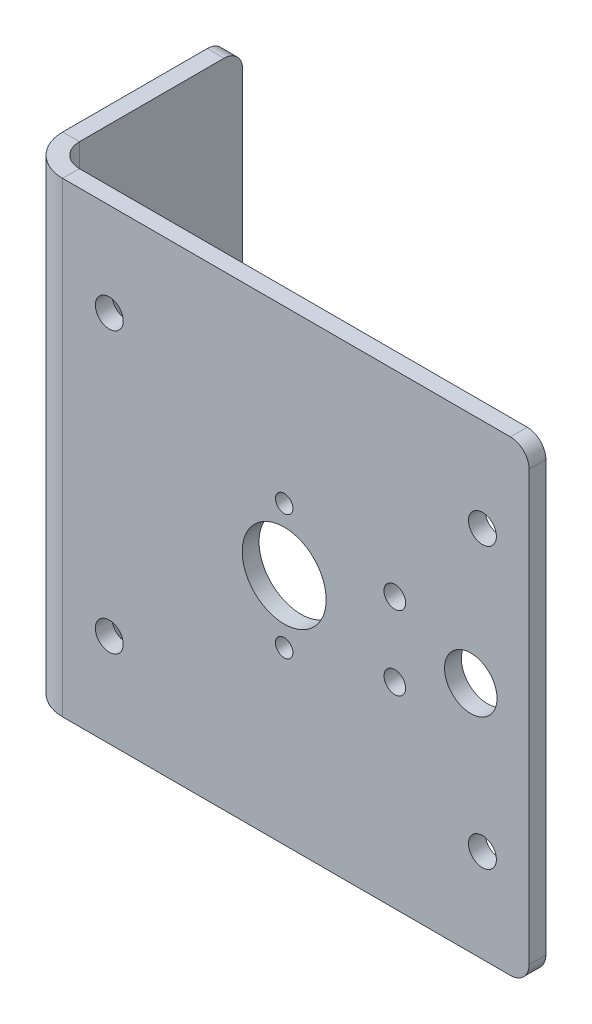
from build123d import *

# Parameters (mm, degrees)
BASE_FLANGE1_DEPTH              = 31.75
FILLET1_R                       = 2.54
F_25_0_1495_DIAMETER_HOLE1_D    = 3.7973
SKETCH10_R                      = 5.715
CUT_EXTRUDE1_DEPTH              = 56.168930099
F_9_32_0_28125_DIAMETER_HOLE1_D = 7.14375
F_3_32_0_09375_DIAMETER_HOLE1_D = 2.38125
F_32_0_116_DIAMETER_HOLE1_D     = 2.9464


# Sheet-metal steps are written as plain solids
with BuildPart() as part:
    # Sketch3 → Base-Flange1 (new, symmetric)
    with BuildSketch(Plane(origin=(0, 0, 0), x_dir=(-1, 0, 0), z_dir=(0, 1, 0))):
        with BuildLine():
            Line((-33.3375, 0), (30.1625, 0))
            ThreePointArc((30.1625, 0), (32.40756403, -0.92993597), (33.3375, -3.175))
            Line((33.3375, -3.175), (33.3375, -25.4))
            Line((33.3375, -25.4), (35.6235, -25.4))
            Line((35.6235, -25.4), (35.6235, -3.175))
            ThreePointArc((35.6235, -3.175), (34.024010132, 0.686510132), (30.1625, 2.286))
            Line((30.1625, 2.286), (-33.3375, 2.286))
            Line((-33.3375, 2.286), (-33.3375, 0))
        make_face()
    extrude(amount=BASE_FLANGE1_DEPTH, both=True)

    # Fillet1
    fillet1_edges = [part.edges().sort_by_distance(p)[0] for p in [
        (33.3375, 31.75, 1.143),
        (33.3375, -31.75, 1.143),
        (-34.4805, 31.75, -25.4),
        (-34.4805, -31.75, -25.4),
    ]]
    fillet(fillet1_edges, radius=FILLET1_R)

    # #25 (0.1495) Diameter Hole1 (through all)
    with Locations(Plane.XY.offset(2.286)):
        with Locations((-23.8125, 19.05), (26.9875, 19.05), (26.9875, -19.05), (-23.8125, -19.05)):
            Hole(F_25_0_1495_DIAMETER_HOLE1_D / 2)

    # Sketch10 → Cut-Extrude1 (cut, through all)
    with BuildSketch(Plane.XY.offset(2.286)):
        Circle(SKETCH10_R)
    extrude(amount=-CUT_EXTRUDE1_DEPTH, mode=Mode.SUBTRACT)

    # 9/32 (0.28125) Diameter Hole1 (through all)
    with Locations(Plane.XY.offset(2.286)):
        with Locations((25.4, 0)):
            Hole(F_9_32_0_28125_DIAMETER_HOLE1_D / 2)

    # 3/32 (0.09375) Diameter Hole1 (through all)
    with Locations(Plane.XY.offset(2.286)):
        with Locations((0, 8.5), (0, -8.5)):
            Hole(F_3_32_0_09375_DIAMETER_HOLE1_D / 2)

    # #32 (0.116) Diameter Hole1 (through all)
    with Locations(Plane.XY.offset(2.286)):
        with Locations((15.057884182, 5.027499276), (15.057884182, -5.027499276)):
            Hole(F_32_0_116_DIAMETER_HOLE1_D / 2)


solid = part.part
